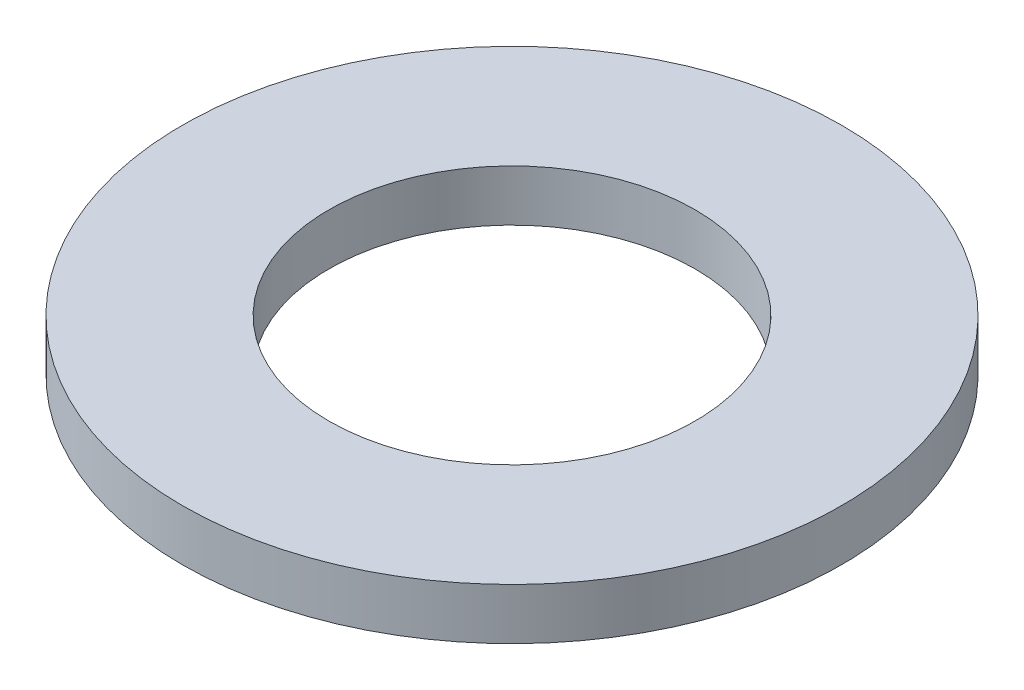
from build123d import *

# Parameters (mm, degrees)
SKETCH1_R           = 90
BOSS_EXTRUDE1_DEPTH = 14
SKETCH2_R           = 50
CUT_EXTRUDE1_DEPTH  = 129.04686642


with BuildPart() as part:
    # Sketch1 → Boss-Extrude1 (new body)
    with BuildSketch(Plane(origin=(0, 0, 0), x_dir=(1, 0, 0), z_dir=(0, 1, 0))):
        Circle(SKETCH1_R)
    extrude(amount=BOSS_EXTRUDE1_DEPTH)

    # Sketch2 → Cut-Extrude1 (cut, through all)
    with BuildSketch(Plane(origin=(0, 0, 0), x_dir=(1, 0, 0), z_dir=(0, 1, 0))):
        Circle(SKETCH2_R)
    extrude(amount=CUT_EXTRUDE1_DEPTH, mode=Mode.SUBTRACT)


solid = part.part
